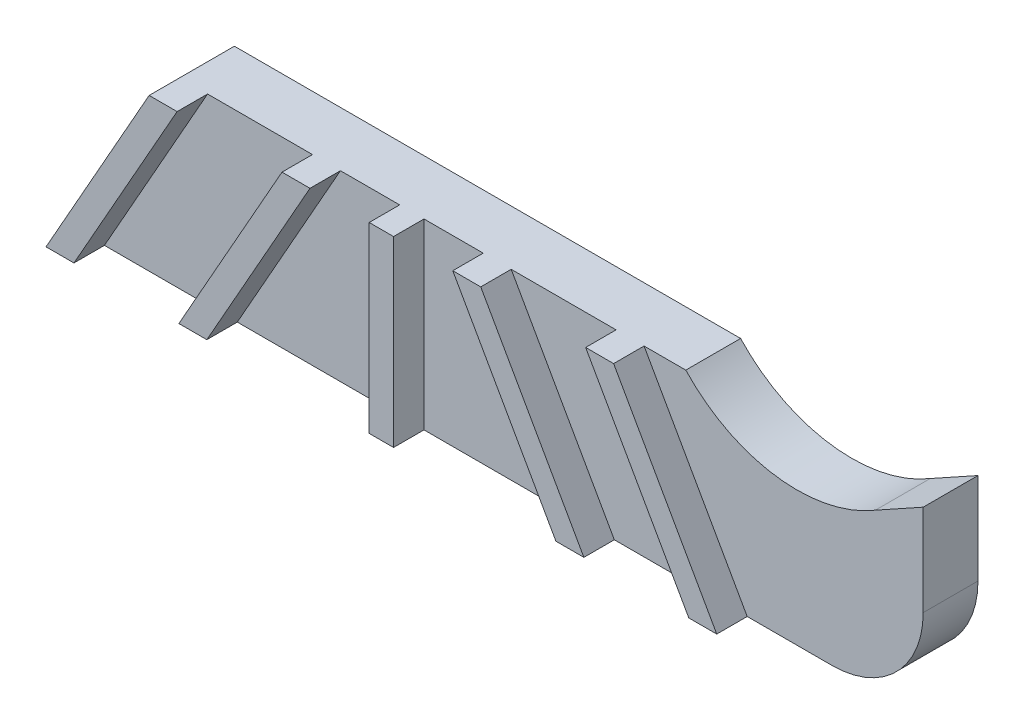
from build123d import *

# Parameters (mm, degrees)
BOSS_EXTRUDE1_DEPTH = 2.8
CUT_EXTRUDE1_DEPTH  = 1


with BuildPart() as part:
    # Sketch1 → Boss-Extrude1 (new body)
    with BuildSketch(Plane(origin=(0, 0, 0), x_dir=(0, 1, 0), z_dir=(0, 0, 1))):
        with BuildLine():
            Line((-2.122941602, 14.254932242), (-2.122941602, -10.553285524))
            ThreePointArc((-2.122941602, -10.553285524), (-1.244261946, -12.674605867), (0.877058398, -13.553285524))
            Line((0.877058398, -13.553285524), (3.877058398, -13.553285524))
            Line((3.877058398, -13.553285524), (3.006420494, -11.983925105))
            ThreePointArc((3.006420494, -11.983925105), (2.340422166, -8.716396804), (3.877058398, -5.756828581))
            Line((3.877058398, -5.756828581), (3.877058398, 10.86753602))
            Line((3.877058398, 10.86753602), (-2.122941602, 14.254932242))
        make_face()
    extrude(amount=BOSS_EXTRUDE1_DEPTH)

    # Sketch2 → Cut-Extrude1 (cut)
    with BuildSketch(Plane.XY.offset(2.8)):
        Polygon((-9.948846585, 3.877058398), (-13.336242806, -2.122941602), (-9.891157424, -2.122941602), (-6.503761203, 3.877058398), align=None)
        Polygon((-8.972467989, -2.122941602), (-5.585071768, 3.877058398), (-3.640563229, 3.877058398), (-3.640563229, -2.122941602), align=None)
        Polygon((-0.896054691, 3.877058398), (-2.840563229, 3.877058398), (-2.840563229, -2.122941602), (2.49134153, -2.122941602), align=None)
        Polygon((6.855116348, -2.122941602), (3.410030966, -2.122941602), (0.022634744, 3.877058398), (3.467720126, 3.877058398), align=None)
        Polygon((4.386409562, 3.877058398), (7.773805783, -2.122941602), (13.553285524, -2.122941602), (13.553285524, 3.877058398), align=None)
    extrude(amount=-CUT_EXTRUDE1_DEPTH, mode=Mode.SUBTRACT)


solid = part.part
